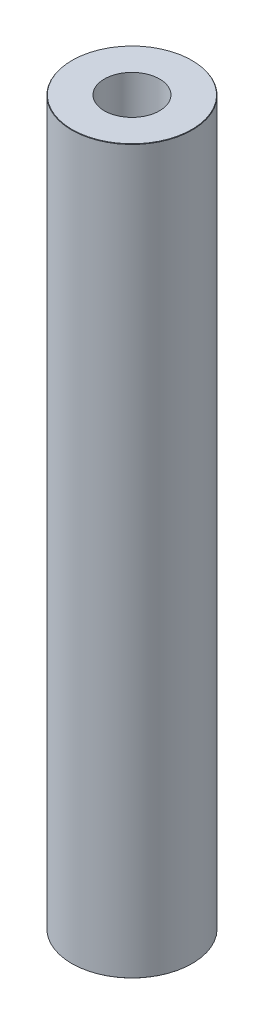
from build123d import *
from OCP.BRepFilletAPI import BRepFilletAPI_MakeChamfer

# Parameters (mm, degrees)
SKETCH1_R           = 50
BOSS_EXTRUDE1_DEPTH = 600
SKETCH2_R           = 22.921124838
CUT_EXTRUDE1_DEPTH  = 605.15229868
CHAMFER1_SIZE       = 0.327249668
CHAMFER1_SIZE2      = 0.272560171


with BuildPart() as part:
    # Sketch1 → Boss-Extrude1 (new body)
    with BuildSketch(Plane(origin=(0, 0, 0), x_dir=(1, 0, 0), z_dir=(0, 1, 0))):
        Circle(SKETCH1_R)
    extrude(amount=BOSS_EXTRUDE1_DEPTH)

    # Sketch2 → Cut-Extrude1 (cut, through all)
    with BuildSketch(Plane(origin=(0, 0, 0), x_dir=(1, 0, 0), z_dir=(0, 1, 0))):
        Circle(SKETCH2_R)
    extrude(amount=CUT_EXTRUDE1_DEPTH, mode=Mode.SUBTRACT)

    # Chamfer1: one chamfer whose edges measure the first distance from different faces: ONE call of the kernel's chamfer builder (chamfer() names one face for all edges)
    chamfer1_edges_1 = [part.edges().sort_by_distance(p)[0] for p in [
        (-50, 600, 0),
    ]]
    chamfer1_side_1 = [part.faces().sort_by_distance(p)[0] for p in [
        (-50, 300, 0),
    ]]
    chamfer1_edges_2 = [part.edges().sort_by_distance(p)[0] for p in [
        (-50, 0, 0),
    ]]
    chamfer1_side_2 = [part.faces().sort_by_distance(p)[0] for p in [
        (-48.585786438, 0, 0),
    ]]
    chamfer1 = BRepFilletAPI_MakeChamfer(part.part.solid().wrapped)
    for e in chamfer1_edges_1:
        chamfer1.Add(CHAMFER1_SIZE, CHAMFER1_SIZE2, e.wrapped, chamfer1_side_1[0].wrapped)  # the first distance lies on this face
    for e in chamfer1_edges_2:
        chamfer1.Add(CHAMFER1_SIZE, CHAMFER1_SIZE2, e.wrapped, chamfer1_side_2[0].wrapped)  # the first distance lies on this face
    add(Compound.cast(chamfer1.Shape()), mode=Mode.REPLACE)


solid = part.part
